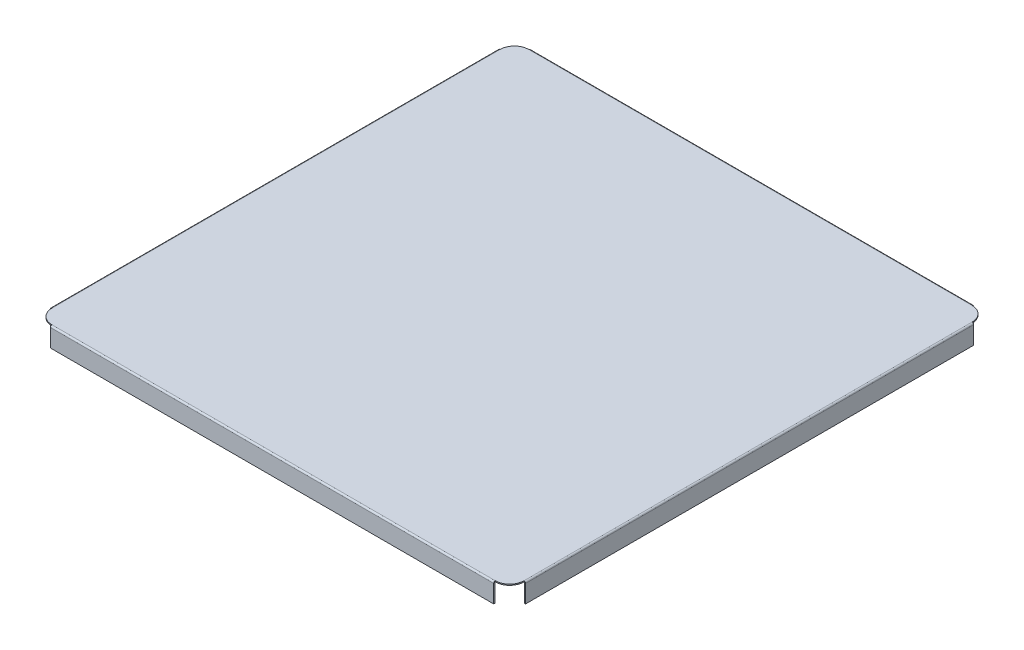
from build123d import *

# Parameters (mm, degrees)
SKETCH1_W                 = 387.38683
SKETCH1_H                 = 391.2598474
BOSS_EXTRUDE1_DEPTH       = 0.035
FILLET1_R                 = 11.811
CONVERT_SOLID1_START      = -0.854
CONVERT_SOLID1_DEPTH      = 0.854
EDGE_FLANGE1_DEPTH        = 367.6378474
EDGE_FLANGE1_BEND_DEPTH   = 363.76483
EDGE_FLANGE1_BEND_2_DEPTH = 367.6378474
EDGE_FLANGE1_BEND_3_DEPTH = 363.76483


# Read off the part's stored shape, not the designer's step: Convert-Solid1
# Sheet-metal steps are written as plain solids
with BuildPart() as part:
    # Sketch1 → Boss-Extrude1 (new body)
    with BuildSketch(Plane(origin=(0, 0, 0), x_dir=(1, 0, 0), z_dir=(0, 1, 0))):
        Rectangle(SKETCH1_W, SKETCH1_H)
    extrude(amount=BOSS_EXTRUDE1_DEPTH)

    # Fillet1
    fillet1_edges = [part.edges().sort_by_distance(p)[0] for p in [
        (193.693415, 0.0175, -195.6299237),
        (193.693415, 0.0175, 195.6299237),
        (-193.693415, 0.0175, 195.6299237),
        (-193.693415, 0.0175, -195.6299237),
    ]]
    fillet(fillet1_edges, radius=FILLET1_R)

    # Convert-Solid1 outline → Convert-Solid1 (add)
    with BuildSketch(Plane(origin=(0, 0, 0), x_dir=(1, 0, 0), z_dir=(0, 1, 0)).offset(CONVERT_SOLID1_START)):
        with BuildLine():
            ThreePointArc((193.693415, 183.8189237), (190.234053193, 192.170561893), (181.882415, 195.6299237))
            Line((181.882415, 195.6299237), (-181.882415, 195.6299237))
            ThreePointArc((-181.882415, 195.6299237), (-190.234053193, 192.170561893), (-193.693415, 183.8189237))
            Line((-193.693415, 183.8189237), (-193.693415, -183.8189237))
            ThreePointArc((-193.693415, -183.8189237), (-190.234053193, -192.170561893), (-181.882415, -195.6299237))
            Line((-181.882415, -195.6299237), (181.882415, -195.6299237))
            ThreePointArc((181.882415, -195.6299237), (190.234053193, -192.170561893), (193.693415, -183.8189237))
            Line((193.693415, -183.8189237), (193.693415, 183.8189237))
        make_face()
    extrude(amount=CONVERT_SOLID1_DEPTH)

    # Edge-Flange1 section (across the edge) → Edge-Flange1 (add)
    with BuildSketch(Plane(origin=(-194.074415, -0.854, 183.8189237), x_dir=(1, 0, 0), z_dir=(0, 0, -1))):
        with BuildLine():
            Line((-0.889, 0.381), (-0.889, 15))
            Line((-0.889, 15), (0, 15))
            Line((0, 15), (0, 0.381))
            ThreePointArc((0, 0.381), (0.111592316, 0.111592316), (0.381, 0))
            Line((0.381, 0), (0.381, -0.889))
            ThreePointArc((0.381, -0.889), (-0.517025612, -0.517025612), (-0.889, 0.381))
        make_face()
    extrude(amount=EDGE_FLANGE1_DEPTH)

    # Edge-Flange1 section 2 (across the edge) → Edge-Flange1 bend (add)
    with BuildSketch(Plane(origin=(181.882415, -0.854, 196.0109237), x_dir=(0, 0, -1), z_dir=(-1, 0, 0))):
        with BuildLine():
            Line((-0.889, 0.381), (-0.889, 15))
            Line((-0.889, 15), (0, 15))
            Line((0, 15), (0, 0.381))
            ThreePointArc((0, 0.381), (0.111592316, 0.111592316), (0.381, 0))
            Line((0.381, 0), (0.381, -0.889))
            ThreePointArc((0.381, -0.889), (-0.517025612, -0.517025612), (-0.889, 0.381))
        make_face()
    extrude(amount=EDGE_FLANGE1_BEND_DEPTH)

    # Edge-Flange1 section 3 (across the edge) → Edge-Flange1 bend 2 (add)
    with BuildSketch(Plane(origin=(194.074415, -0.854, -183.8189237), x_dir=(-1, 0, 0), z_dir=(0, 0, 1))):
        with BuildLine():
            Line((-0.889, 0.381), (-0.889, 15))
            Line((-0.889, 15), (0, 15))
            Line((0, 15), (0, 0.381))
            ThreePointArc((0, 0.381), (0.111592316, 0.111592316), (0.381, 0))
            Line((0.381, 0), (0.381, -0.889))
            ThreePointArc((0.381, -0.889), (-0.517025612, -0.517025612), (-0.889, 0.381))
        make_face()
    extrude(amount=EDGE_FLANGE1_BEND_2_DEPTH)

    # Edge-Flange1 section 4 (across the edge) → Edge-Flange1 bend 3 (add)
    with BuildSketch(Plane(origin=(-181.882415, -0.854, -196.0109237), x_dir=(0, 0, 1), z_dir=(1, 0, 0))):
        with BuildLine():
            Line((-0.889, 0.381), (-0.889, 15))
            Line((-0.889, 15), (0, 15))
            Line((0, 15), (0, 0.381))
            ThreePointArc((0, 0.381), (0.111592316, 0.111592316), (0.381, 0))
            Line((0.381, 0), (0.381, -0.889))
            ThreePointArc((0.381, -0.889), (-0.517025612, -0.517025612), (-0.889, 0.381))
        make_face()
    extrude(amount=EDGE_FLANGE1_BEND_3_DEPTH)


solid = part.part
